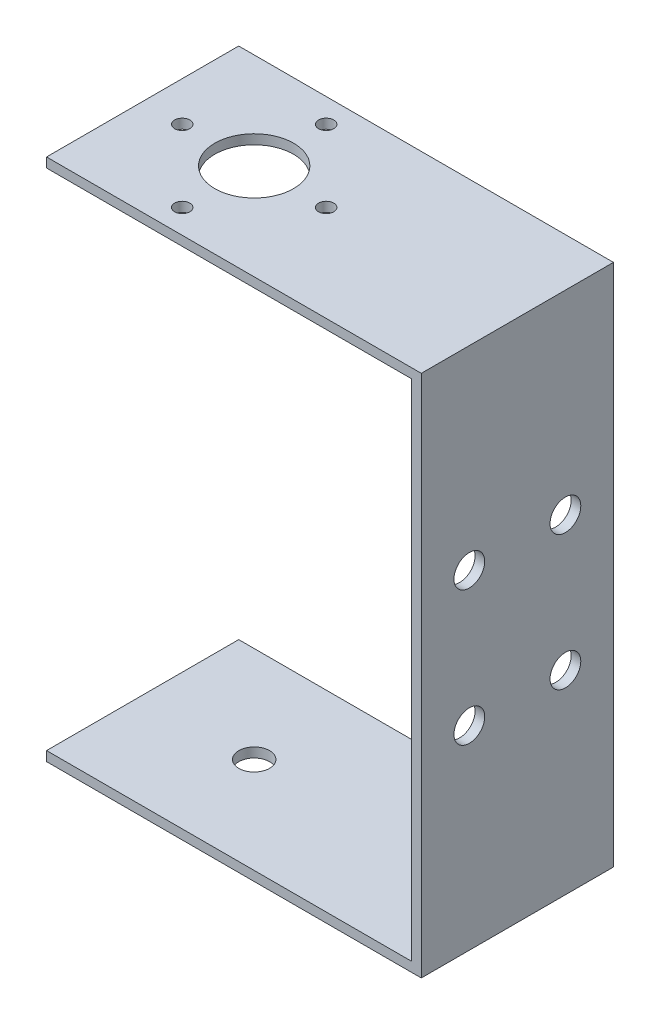
from build123d import *

# Parameters (mm, degrees)
SKETCH_1_W           = 20
SKETCH_1_H           = 54.5
EXTRUDE_1_DEPTH      = 1
SKETCH_2_W           = 20
SKETCH_2_H           = 1
EXTRUDE_2_DEPTH      = 38
SKETCH_3_W           = 20
SKETCH_3_H           = 1
EXTRUDE_3_DEPTH      = 38
SKETCH_4_R           = 4.1
CUT_EXTRUDE_1_DEPTH  = 1
SKETCH_5_R           = 0.79
CUT_EXTRUDE_2_DEPTH  = 1
SKETCH_6_R           = 0.79
CUT_EXTRUDE_3_DEPTH  = 1
SKETCH_7_R           = 0.79
CUT_EXTRUDE_4_DEPTH  = 1
SKETCH_8_R           = 0.79
CUT_EXTRUDE_5_DEPTH  = 1
SKETCH_9_R           = 1.6
CUT_EXTRUDE_6_DEPTH  = 1
SKETCH_10_R          = 1.6
CUT_EXTRUDE_7_DEPTH  = 1
SKETCH_11_R          = 1.6
CUT_EXTRUDE_8_DEPTH  = 1
SKETCH_12_R          = 1.6
CUT_EXTRUDE_9_DEPTH  = 1
SKETCH_13_R          = 1.6
CUT_EXTRUDE_10_DEPTH = 1


with BuildPart() as part:
    # ｽｹｯﾁ1 → ﾎﾞｽ - 押し出し1 (new body)
    with BuildSketch(Plane(origin=(0, 0, 0), x_dir=(0, 0, -1), z_dir=(1, 0, 0))):
        with Locations((10, 27.25)):
            Rectangle(SKETCH_1_W, SKETCH_1_H)
    extrude(amount=EXTRUDE_1_DEPTH)

    # ｽｹｯﾁ2 → ﾎﾞｽ - 押し出し2 (add)
    with BuildSketch(Plane.ZY):
        with Locations((-10, 54)):
            Rectangle(SKETCH_2_W, SKETCH_2_H)
    extrude(amount=EXTRUDE_2_DEPTH)

    # ｽｹｯﾁ3 → ﾎﾞｽ - 押し出し3 (add)
    with BuildSketch(Plane.ZY):
        with Locations((-10, 0.5)):
            Rectangle(SKETCH_3_W, SKETCH_3_H)
    extrude(amount=EXTRUDE_3_DEPTH)

    # ｽｹｯﾁ4 → ｶｯﾄ - 押し出し1 (cut)
    with BuildSketch(Plane(origin=(0, 54.5, 0), x_dir=(1, 0, 0), z_dir=(0, 1, 0))):
        with Locations((-26.39, 10)):
            Circle(SKETCH_4_R)
    extrude(amount=-CUT_EXTRUDE_1_DEPTH, mode=Mode.SUBTRACT)

    # ｽｹｯﾁ5 → ｶｯﾄ - 押し出し2 (cut)
    with BuildSketch(Plane(origin=(0, 54.5, 0), x_dir=(1, 0, 0), z_dir=(0, 1, 0))):
        with Locations((-33.88, 10)):
            Circle(SKETCH_5_R)
    extrude(amount=-CUT_EXTRUDE_2_DEPTH, mode=Mode.SUBTRACT)

    # ｽｹｯﾁ6 → ｶｯﾄ - 押し出し3 (cut)
    with BuildSketch(Plane(origin=(0, 54.5, 0), x_dir=(1, 0, 0), z_dir=(0, 1, 0))):
        with Locations((-18.9, 10)):
            Circle(SKETCH_6_R)
    extrude(amount=-CUT_EXTRUDE_3_DEPTH, mode=Mode.SUBTRACT)

    # ｽｹｯﾁ7 → ｶｯﾄ - 押し出し4 (cut)
    with BuildSketch(Plane(origin=(0, 54.5, 0), x_dir=(1, 0, 0), z_dir=(0, 1, 0))):
        with Locations((-26.39, 2.51)):
            Circle(SKETCH_7_R)
    extrude(amount=-CUT_EXTRUDE_4_DEPTH, mode=Mode.SUBTRACT)

    # ｽｹｯﾁ8 → ｶｯﾄ - 押し出し5 (cut)
    with BuildSketch(Plane(origin=(0, 54.5, 0), x_dir=(1, 0, 0), z_dir=(0, 1, 0))):
        with Locations((-26.39, 17.49)):
            Circle(SKETCH_8_R)
    extrude(amount=-CUT_EXTRUDE_5_DEPTH, mode=Mode.SUBTRACT)

    # ｽｹｯﾁ9 → ｶｯﾄ - 押し出し6 (cut)
    with BuildSketch(Plane(origin=(0, 0, 0), x_dir=(-1, 0, 0), z_dir=(0, -1, 0))):
        with Locations((26.39, 10)):
            Circle(SKETCH_9_R)
    extrude(amount=-CUT_EXTRUDE_6_DEPTH, mode=Mode.SUBTRACT)

    # ｽｹｯﾁ10 → ｶｯﾄ - 押し出し7 (cut)
    with BuildSketch(Plane(origin=(1, 0, 0), x_dir=(0, 0, -1), z_dir=(1, 0, 0))):
        with Locations((5, 34.25)):
            Circle(SKETCH_10_R)
    extrude(amount=-CUT_EXTRUDE_7_DEPTH, mode=Mode.SUBTRACT)

    # ｽｹｯﾁ11 → ｶｯﾄ - 押し出し8 (cut)
    with BuildSketch(Plane(origin=(1, 0, 0), x_dir=(0, 0, -1), z_dir=(1, 0, 0))):
        with Locations((15, 34.25)):
            Circle(SKETCH_11_R)
    extrude(amount=-CUT_EXTRUDE_8_DEPTH, mode=Mode.SUBTRACT)

    # ｽｹｯﾁ12 → ｶｯﾄ - 押し出し9 (cut)
    with BuildSketch(Plane(origin=(1, 0, 0), x_dir=(0, 0, -1), z_dir=(1, 0, 0))):
        with Locations((5, 20.25)):
            Circle(SKETCH_12_R)
    extrude(amount=-CUT_EXTRUDE_9_DEPTH, mode=Mode.SUBTRACT)

    # ｽｹｯﾁ13 → ｶｯﾄ - 押し出し10 (cut)
    with BuildSketch(Plane(origin=(1, 0, 0), x_dir=(0, 0, -1), z_dir=(1, 0, 0))):
        with Locations((15, 20.25)):
            Circle(SKETCH_13_R)
    extrude(amount=-CUT_EXTRUDE_10_DEPTH, mode=Mode.SUBTRACT)


solid = part.part
